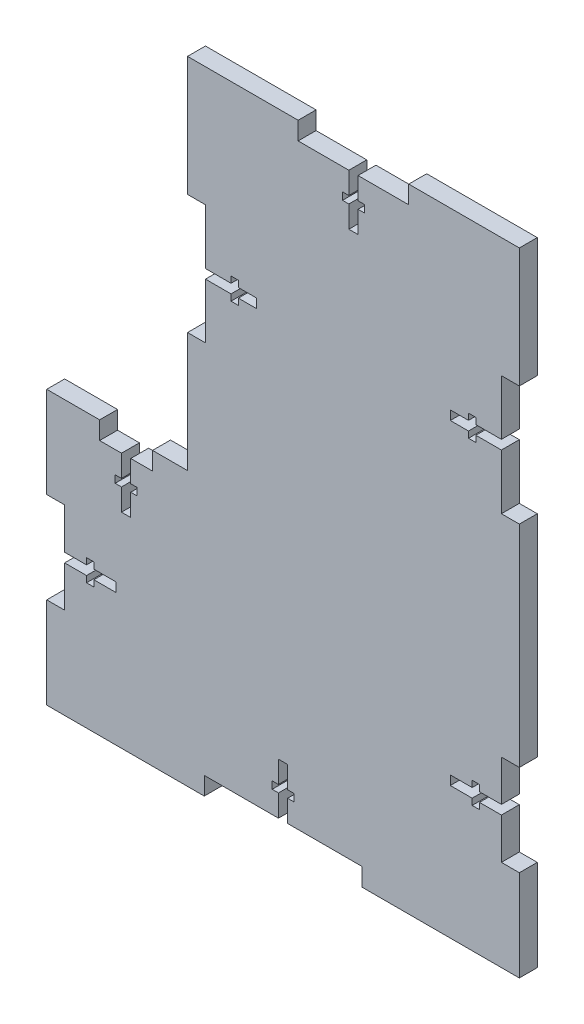
from build123d import *

# Parameters (mm, degrees)
SKETCH1_W           = 133.858
SKETCH1_H           = 77.47
BOSS_EXTRUDE1_DEPTH = 5.08
SKETCH2_W           = 14.986
SKETCH2_H           = 5.08
CUT_EXTRUDE1_DEPTH  = 78.496436473
SKETCH3_W           = 5.08
SKETCH3_H           = 25.823333334
CUT_EXTRUDE2_DEPTH  = 78.496436473
SKETCH4_W           = 14.478
SKETCH4_H           = 2.6035
CUT_EXTRUDE3_DEPTH  = 78.496436473
SKETCH5_W           = 2.6035
SKETCH5_H           = 14.478
CUT_EXTRUDE4_DEPTH  = 78.496436473
SKETCH6_W           = 6.1722
SKETCH6_H           = 2.0828
SKETCH6_W_2         = 2.0828
SKETCH6_H_2         = 6.1722
CUT_EXTRUDE5_DEPTH  = 78.496436473
SKETCH7_W           = 93.98
SKETCH7_H           = 101.6
BOSS_EXTRUDE2_DEPTH = 5.08
SKETCH8_W           = 44.619333334
SKETCH8_H           = 5.08
CUT_EXTRUDE6_DEPTH  = 156.560951611
SKETCH10_W          = 2.6035
SKETCH10_H          = 14.478
CUT_EXTRUDE7_DEPTH  = 156.560951611
SKETCH11_W          = 6.1722
SKETCH11_H          = 2.0828
CUT_EXTRUDE8_DEPTH  = 156.560951611
SKETCH12_W          = 5.08
SKETCH12_H          = 33.866666666
CUT_EXTRUDE9_DEPTH  = 156.560951611
SKETCH13_W          = 14.478
SKETCH13_H          = 2.6035
SKETCH13_W_2        = 2.6035
SKETCH13_H_2        = 19.558
CUT_EXTRUDE10_DEPTH = 156.560951611
SKETCH14_W          = 2.0828
SKETCH14_H          = 6.1722
SKETCH14_W_2        = 6.1722
SKETCH14_H_2        = 2.0828
CUT_EXTRUDE11_DEPTH = 156.560951611
SKETCH15_W          = 31.326666666
SKETCH15_H          = 5.08
CUT_EXTRUDE12_DEPTH = 156.560951611


with BuildPart() as part:
    # Sketch1 → Boss-Extrude1 (new body)
    with BuildSketch(Plane.XY):
        Rectangle(SKETCH1_W, SKETCH1_H)
    extrude(amount=BOSS_EXTRUDE1_DEPTH)

    # Sketch2 → Cut-Extrude1 (cut, through all)
    with BuildSketch(Plane.XY.offset(5.08)):
        with Locations((-44.45, 36.195)):
            Rectangle(SKETCH2_W, SKETCH2_H)
    extrude(amount=-CUT_EXTRUDE1_DEPTH, mode=Mode.SUBTRACT)

    # Sketch3 → Cut-Extrude2 (cut, through all)
    with BuildSketch(Plane.XY.offset(5.08)):
        with Locations((-64.389, 0)):
            Rectangle(SKETCH3_W, SKETCH3_H)
        with Locations((64.389, 0)):
            Rectangle(SKETCH3_W, SKETCH3_H)
    extrude(amount=-CUT_EXTRUDE2_DEPTH, mode=Mode.SUBTRACT)

    # Sketch4 → Cut-Extrude3 (cut, through all)
    with BuildSketch(Plane.XY.offset(5.08)):
        with Locations((-54.61, 0)):
            Rectangle(SKETCH4_W, SKETCH4_H)
        with Locations((54.61, 0)):
            Rectangle(SKETCH4_W, SKETCH4_H)
    extrude(amount=-CUT_EXTRUDE3_DEPTH, mode=Mode.SUBTRACT)

    # Sketch5 → Cut-Extrude4 (cut, through all)
    with BuildSketch(Plane.XY.offset(5.08)):
        with Locations((-44.45, 26.416)):
            Rectangle(SKETCH5_W, SKETCH5_H)
    extrude(amount=-CUT_EXTRUDE4_DEPTH, mode=Mode.SUBTRACT)

    # Sketch6 → Cut-Extrude5 (cut, through all)
    with BuildSketch(Plane.XY.offset(5.08)):
        with Locations((-44.45, 26.416)):
            Rectangle(SKETCH6_W, SKETCH6_H)
        with Locations((-54.61, 0)):
            Rectangle(SKETCH6_W_2, SKETCH6_H_2)
        with Locations((54.61, 0)):
            Rectangle(SKETCH6_W_2, SKETCH6_H_2)
    extrude(amount=-CUT_EXTRUDE5_DEPTH, mode=Mode.SUBTRACT)

    # Sketch7 → Boss-Extrude2 (add)
    with BuildSketch(Plane.XY.offset(5.08)):
        with Locations((19.939, 89.535)):
            Rectangle(SKETCH7_W, SKETCH7_H)
    extrude(amount=-BOSS_EXTRUDE2_DEPTH)

    # Sketch8 → Cut-Extrude6 (cut, through all)
    with BuildSketch(Plane.XY.offset(5.08)):
        with Locations((0, -36.195)):
            Rectangle(SKETCH8_W, SKETCH8_H)
    extrude(amount=-CUT_EXTRUDE6_DEPTH, mode=Mode.SUBTRACT)

    # Sketch10 → Cut-Extrude7 (cut, through all)
    with BuildSketch(Plane.XY.offset(5.08)):
        with Locations((0, -26.416)):
            Rectangle(SKETCH10_W, SKETCH10_H)
    extrude(amount=-CUT_EXTRUDE7_DEPTH, mode=Mode.SUBTRACT)

    # Sketch11 → Cut-Extrude8 (cut, through all)
    with BuildSketch(Plane.XY.offset(5.08)):
        with Locations((0, -26.416)):
            Rectangle(SKETCH11_W, SKETCH11_H)
    extrude(amount=-CUT_EXTRUDE8_DEPTH, mode=Mode.SUBTRACT)

    # Sketch12 → Cut-Extrude9 (cut, through all)
    with BuildSketch(Plane.XY.offset(5.08)):
        with Locations((64.389, 89.535)):
            Rectangle(SKETCH12_W, SKETCH12_H)
        with Locations((-24.511, 89.535)):
            Rectangle(SKETCH12_W, SKETCH12_H)
    extrude(amount=-CUT_EXTRUDE9_DEPTH, mode=Mode.SUBTRACT)

    # Sketch13 → Cut-Extrude10 (cut, through all)
    with BuildSketch(Plane.XY.offset(5.08)):
        with Locations((-14.732, 89.535)):
            Rectangle(SKETCH13_W, SKETCH13_H)
        with Locations((54.61, 89.535)):
            Rectangle(SKETCH13_W, SKETCH13_H)
        with Locations((19.939, 130.556)):
            Rectangle(SKETCH13_W_2, SKETCH13_H_2)
    extrude(amount=-CUT_EXTRUDE10_DEPTH, mode=Mode.SUBTRACT)

    # Sketch14 → Cut-Extrude11 (cut, through all)
    with BuildSketch(Plane.XY.offset(5.08)):
        with Locations((53.5686, 89.535)):
            Rectangle(SKETCH14_W, SKETCH14_H)
        with Locations((-13.6906, 89.535)):
            Rectangle(SKETCH14_W, SKETCH14_H)
        with Locations((19.939, 128.016)):
            Rectangle(SKETCH14_W_2, SKETCH14_H_2)
    extrude(amount=-CUT_EXTRUDE11_DEPTH, mode=Mode.SUBTRACT)

    # Sketch15 → Cut-Extrude12 (cut, through all)
    with BuildSketch(Plane.XY.offset(5.08)):
        with Locations((19.939, 137.795)):
            Rectangle(SKETCH15_W, SKETCH15_H)
    extrude(amount=-CUT_EXTRUDE12_DEPTH, mode=Mode.SUBTRACT)


solid = part.part
